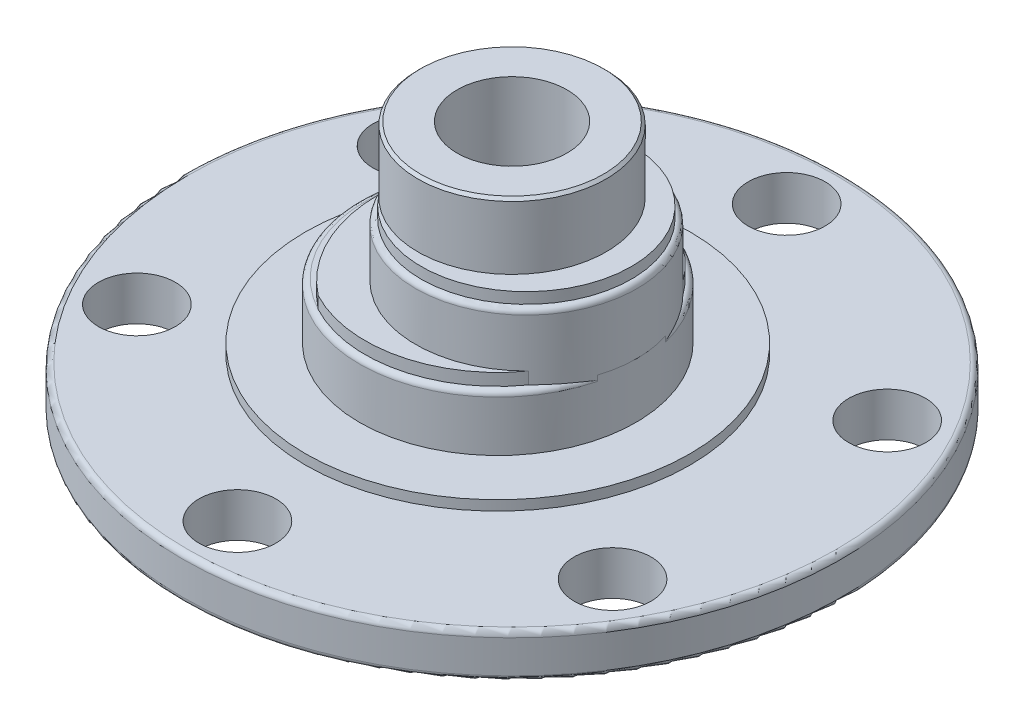
from build123d import *

# Parameters (mm, degrees)
SKETCH1_R           = 30
SKETCH1_R_2         = 2.05
BOSS_EXTRUDE1_DEPTH = 4
SKETCH2_R           = 12.575
BOSS_EXTRUDE2_DEPTH = 6
SKETCH3_R           = 10.075
BOSS_EXTRUDE3_DEPTH = 6
FILLET1_R           = 0.5
SKETCH4_R           = 3.5
CUT_EXTRUDE1_DEPTH  = 4
SKETCH5_R           = 8.575
BOSS_EXTRUDE4_DEPTH = 7
SKETCH6_R           = 17.5
SKETCH6_R_2         = 12.575
BOSS_EXTRUDE5_DEPTH = 0.9
BOSS_EXTRUDE6_DEPTH = 1.1
CHAMFER1_SIZE       = 0.25
BOSS_EXTRUDE7_DEPTH = 1
CUT_EXTRUDE2_REACH  = 50.26
SKETCH9_R           = 5
SKETCH10_R          = 10
CUT_EXTRUDE3_DEPTH  = 7


with BuildPart() as part:
    # Sketch1 → Boss-Extrude1 (new body)
    with BuildSketch(Plane(origin=(0, 0, 0), x_dir=(1, 0, 0), z_dir=(0, 1, 0))):
        Circle(SKETCH1_R)
        with Locations((0, 25)):
            Circle(SKETCH1_R_2, mode=Mode.SUBTRACT)
        with Locations((21.650635095, 12.5)):
            Circle(SKETCH1_R_2, mode=Mode.SUBTRACT)
        with Locations((21.650635095, -12.5)):
            Circle(SKETCH1_R_2, mode=Mode.SUBTRACT)
        with Locations((0, -25)):
            Circle(SKETCH1_R_2, mode=Mode.SUBTRACT)
        with Locations((-21.650635095, -12.5)):
            Circle(SKETCH1_R_2, mode=Mode.SUBTRACT)
        with Locations((-21.650635095, 12.5)):
            Circle(SKETCH1_R_2, mode=Mode.SUBTRACT)
    extrude(amount=BOSS_EXTRUDE1_DEPTH)

    # Sketch2 → Boss-Extrude2 (add)
    with BuildSketch(Plane(origin=(0, 4, 0), x_dir=(1, 0, 0), z_dir=(0, 1, 0))):
        with Locations((-1.3, 0)):
            Circle(SKETCH2_R)
    extrude(amount=BOSS_EXTRUDE2_DEPTH)

    # Sketch3 → Boss-Extrude3 (add)
    with BuildSketch(Plane(origin=(0, 10, 0), x_dir=(1, 0, 0), z_dir=(0, 1, 0))):
        with Locations((1.3, 0)):
            Circle(SKETCH3_R)
    extrude(amount=BOSS_EXTRUDE3_DEPTH)

    # Fillet1
    fillet1_edges = [part.edges().sort_by_distance(p)[0] for p in [
        (-8.775, 16, 0),
        (-13.875, 10, 0),
        (-30, 0, 0),
        (-30, 4, 0),
    ]]
    fillet(fillet1_edges, radius=FILLET1_R)

    # Sketch4 → Cut-Extrude1 (cut)
    with BuildSketch(Plane(origin=(0, 4, 0), x_dir=(1, 0, 0), z_dir=(0, 1, 0))):
        with Locations((0, 25)):
            Circle(SKETCH4_R)
        with Locations((21.650635095, 12.5)):
            Circle(SKETCH4_R)
        with Locations((21.650635095, -12.5)):
            Circle(SKETCH4_R)
        with Locations((0, -25)):
            Circle(SKETCH4_R)
        with Locations((-21.650635095, -12.5)):
            Circle(SKETCH4_R)
        with Locations((-21.650635095, 12.5)):
            Circle(SKETCH4_R)
    extrude(amount=-CUT_EXTRUDE1_DEPTH, mode=Mode.SUBTRACT)

    # Sketch5 → Boss-Extrude4 (add)
    with BuildSketch(Plane(origin=(0, 16, 0), x_dir=(1, 0, 0), z_dir=(0, 1, 0))):
        Circle(SKETCH5_R)
    extrude(amount=BOSS_EXTRUDE4_DEPTH)

    # Sketch6 → Boss-Extrude5 (add)
    with BuildSketch(Plane(origin=(0, 4, 0), x_dir=(1, 0, 0), z_dir=(0, 1, 0))):
        with Locations((-1.3, 0)):
            Circle(SKETCH6_R)
        with Locations((-1.3, 0)):
            Circle(SKETCH6_R_2, mode=Mode.SUBTRACT)
    extrude(amount=BOSS_EXTRUDE5_DEPTH)

    # Sketch7 → Boss-Extrude6 (add)
    with BuildSketch(Plane(origin=(0, 10, 0), x_dir=(1, 0, 0), z_dir=(0, 1, 0))):
        with BuildLine():
            ThreePointArc((8.519230769, -7.027683267), (-8.775, 0), (8.519230769, 7.027683267))
            ThreePointArc((8.519230769, 7.027683267), (1.436311663, 11.760876816), (-7.008533654, 10.640407348))
            ThreePointArc((-7.008533654, 10.640407348), (-12.2, 0), (-7.008533654, -10.640407348))
            ThreePointArc((-7.008533654, -10.640407348), (1.436311663, -11.760876816), (8.519230769, -7.027683267))
        make_face()
    extrude(amount=BOSS_EXTRUDE6_DEPTH)

    # Chamfer1
    chamfer1_edges = [part.edges().sort_by_distance(p)[0] for p in [
        (-8.575, 23, 0),
    ]]
    chamfer(chamfer1_edges, length=CHAMFER1_SIZE)

    # Sketch8 → Boss-Extrude7 (add)
    with BuildSketch(Plane(origin=(0, 16, 0), x_dir=(1, 0, 0), z_dir=(0, 1, 0))):
        with BuildLine():
            ThreePointArc((-6.330769231, 5.783769182), (3.101957354, 7.994278302), (8.575, 0))
            ThreePointArc((8.575, 0), (3.101957354, -7.994278302), (-6.330769231, -5.783769182))
            ThreePointArc((-6.330769231, -5.783769182), (10.875, 0), (-6.330769231, 5.783769182))
        make_face()
    extrude(amount=BOSS_EXTRUDE7_DEPTH)

    # Sketch9 → Cut-Extrude2 (cut, up to next)
    with BuildSketch(Plane(origin=(0, 23, 0), x_dir=(1, 0, 0), z_dir=(0, 1, 0)), mode=Mode.PRIVATE) as cut_extrude2_sk1:
        Circle(SKETCH9_R)
    cut_extrude2_tool1 = extrude(cut_extrude2_sk1.sketch, amount=-CUT_EXTRUDE2_REACH, mode=Mode.PRIVATE) & part.part
    add(cut_extrude2_tool1.solids().sort_by_distance((0, 23, 0))[0], mode=Mode.SUBTRACT)

    # Sketch10 → Cut-Extrude3 (cut)
    with BuildSketch(Plane.XZ):
        Circle(SKETCH10_R)
    extrude(amount=-CUT_EXTRUDE3_DEPTH, mode=Mode.SUBTRACT)


solid = part.part
